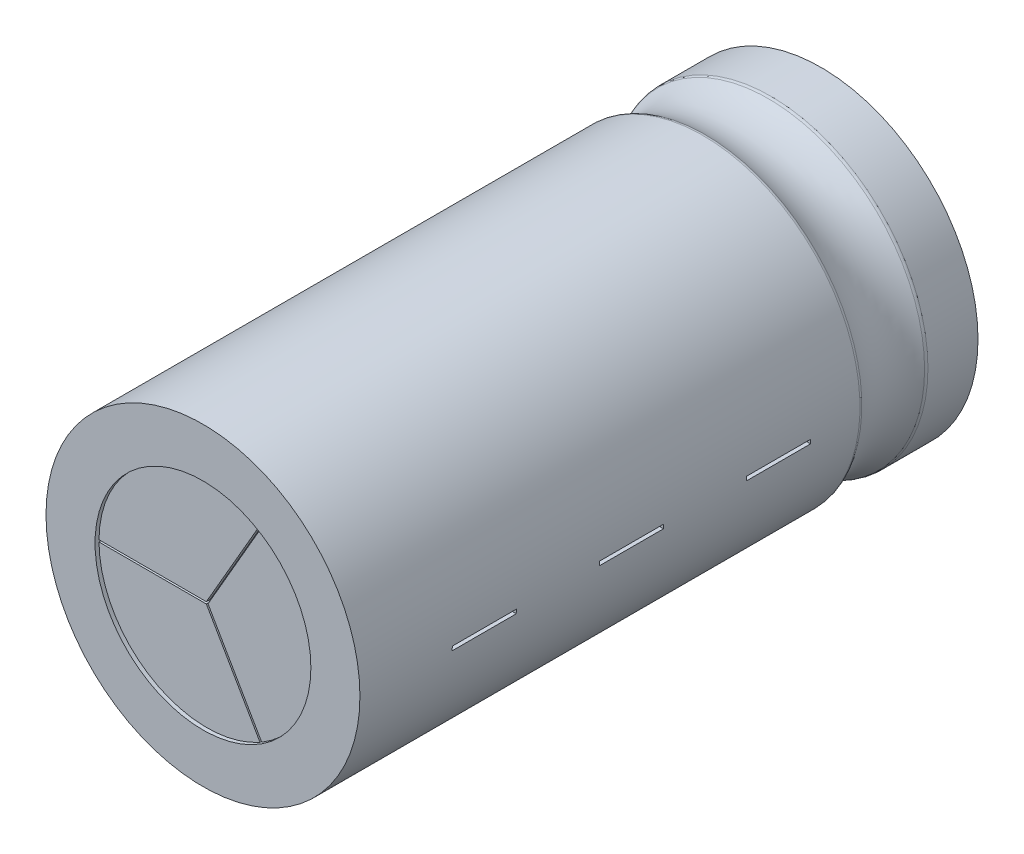
from build123d import *

# Parameters (mm, degrees)
SKETCH_1_R          = 8
EXTRUDE_1_DEPTH     = 31.5
SKETCH_2_R          = 5.5
CUT_EXTRUDE_1_DEPTH = 0.2
CUT_EXTRUDE_2_DEPTH = 0.2
FILLET_1_R          = 0.25
SKETCH_5_R          = 0.6
EXTRUDE_2_DEPTH     = 2
WRAP_START          = 8.527777778
WRAP_2_DEPTH        = 3.263888889
WRAP_START_2        = 16.027777778
WRAP_2_2_DEPTH      = 3.263888889
WRAP_START_3        = 23.527777778
WRAP_2_3_DEPTH      = 3.263888889


# Read off the part's stored shape, not the designer's step: 包覆2
with BuildPart() as part:
    # 草图1 → 凸台-拉伸1 (new body)
    with BuildSketch(Plane.XY):
        Circle(SKETCH_1_R)
    extrude(amount=EXTRUDE_1_DEPTH)

    # 草图2 → 切除-拉伸1 (cut)
    with BuildSketch(Plane.XY.offset(31.5)):
        Circle(SKETCH_2_R)
    extrude(amount=-CUT_EXTRUDE_1_DEPTH, mode=Mode.SUBTRACT)

    # 草图3 → 切除-拉伸2 (cut)
    with BuildSketch(Plane.XY.offset(31.3)):
        with BuildLine():
            Line((-0.04330127, 0.025), (-0.028867513, 0.05))
            Line((-0.028867513, 0.05), (-5.499772723, 0.05))
            ThreePointArc((-5.499772723, 0.05), (-5.5, 0), (-5.499772723, -0.05))
            Line((-5.499772723, -0.05), (-0.028867513, -0.05))
            Line((-0.028867513, -0.05), (-0.04330127, -0.025))
            Line((-0.04330127, -0.025), (0, 0))
            Line((0, 0), (-0.04330127, 0.025))
        make_face()
        with BuildLine():
            Line((0.04330127, -0.025), (0, 0))
            Line((0, 0), (0, -0.05))
            Line((0, -0.05), (-0.028867513, -0.05))
            Line((-0.028867513, -0.05), (2.706585091, -4.787942893))
            ThreePointArc((2.706585091, -4.787942893), (2.75, -4.763139721), (2.793187631, -4.737942893))
            Line((2.793187631, -4.737942893), (0.057735027, 0))
            Line((0.057735027, 0), (0.04330127, -0.025))
        make_face()
        with BuildLine():
            Line((-0.028867513, 0.05), (0, 0.05))
            Line((0, 0.05), (0, 0))
            Line((0, 0), (0.04330127, 0.025))
            Line((0.04330127, 0.025), (0.057735027, 0))
            Line((0.057735027, 0), (2.793187631, 4.737942893))
            ThreePointArc((2.793187631, 4.737942893), (2.75, 4.763139721), (2.706585091, 4.787942893))
            Line((2.706585091, 4.787942893), (-0.028867513, 0.05))
        make_face()
        Polygon((0, 0), (0, 0.05), (-0.028867513, 0.05), (-0.04330127, 0.025), align=None)
        Polygon((0, -0.05), (0, 0), (-0.04330127, -0.025), (-0.028867513, -0.05), align=None)
        Polygon((0.04330127, 0.025), (0, 0), (0.04330127, -0.025), (0.057735027, 0), align=None)
    extrude(amount=-CUT_EXTRUDE_2_DEPTH, mode=Mode.SUBTRACT)

    # 草图4 → 切除-旋转1 (revolve, cut)
    with BuildSketch(Plane(origin=(0, 0, 0), x_dir=(1, 0, 0), z_dir=(0, 1, 0))):
        with BuildLine():
            Line((-8.318421305, -2.223982894), (-8.318421305, -6.342581877))
            ThreePointArc((-8.318421305, -6.342581877), (-7.5, -4.283282386), (-8.318421305, -2.223982894))
        make_face()
    revolve(axis=Axis((0, 0, 0), (0, 0, 1)), mode=Mode.SUBTRACT)

    # 圆角1
    fillet_1_edges = [part.edges().sort_by_distance(p)[0] for p in [
        (0, 8, 5.941594781),
        (0, -8, 2.62496999),
    ]]
    fillet(fillet_1_edges, radius=FILLET_1_R)

    # 草图5 → 凸台-拉伸2 (add)
    with BuildSketch(Plane(origin=(0, 0, 0), x_dir=(-1, 0, 0), z_dir=(0, 0, -1))):
        with Locations(Location((3.5, 0, 0), (0, 0, 180))):
            Circle(SKETCH_5_R)
        with Locations(Location((-3.5, 0, 0), (0, 0, 180))):
            Circle(SKETCH_5_R)
    extrude(amount=EXTRUDE_2_DEPTH)

    # 包覆2 outline → 包覆2 (cut)
    with BuildSketch(Plane.XY.offset(WRAP_START)):
        with BuildLine():
            Line((7.998541229, -0.152768492), (6.998723575, -0.13367243))
            ThreePointArc((6.998723575, -0.13367243), (6.996389817, -0.224787737), (6.992869893, -0.315864933))
            Line((6.992869893, -0.315864933), (7.991851307, -0.360988495))
            ThreePointArc((7.991851307, -0.360988495), (7.995874077, -0.256900271), (7.998541229, -0.152768492))
        make_face()
    extrude(amount=WRAP_2_DEPTH, mode=Mode.SUBTRACT)

    # Wrap 2 2 outline → Wrap 2 2 (cut)
    with BuildSketch(Plane.XY.offset(WRAP_START_2)):
        with BuildLine():
            Line((7.998541229, -0.152768492), (6.998723575, -0.13367243))
            ThreePointArc((6.998723575, -0.13367243), (6.996389817, -0.224787737), (6.992869893, -0.315864933))
            Line((6.992869893, -0.315864933), (7.991851307, -0.360988495))
            ThreePointArc((7.991851307, -0.360988495), (7.995874077, -0.256900271), (7.998541229, -0.152768492))
        make_face()
    extrude(amount=WRAP_2_2_DEPTH, mode=Mode.SUBTRACT)

    # Wrap 2 3 outline → Wrap 2 3 (cut)
    with BuildSketch(Plane.XY.offset(WRAP_START_3)):
        with BuildLine():
            Line((7.998541229, -0.152768492), (6.998723575, -0.13367243))
            ThreePointArc((6.998723575, -0.13367243), (6.996389817, -0.224787737), (6.992869893, -0.315864933))
            Line((6.992869893, -0.315864933), (7.991851307, -0.360988495))
            ThreePointArc((7.991851307, -0.360988495), (7.995874077, -0.256900271), (7.998541229, -0.152768492))
        make_face()
    extrude(amount=WRAP_2_3_DEPTH, mode=Mode.SUBTRACT)


solid = part.part
